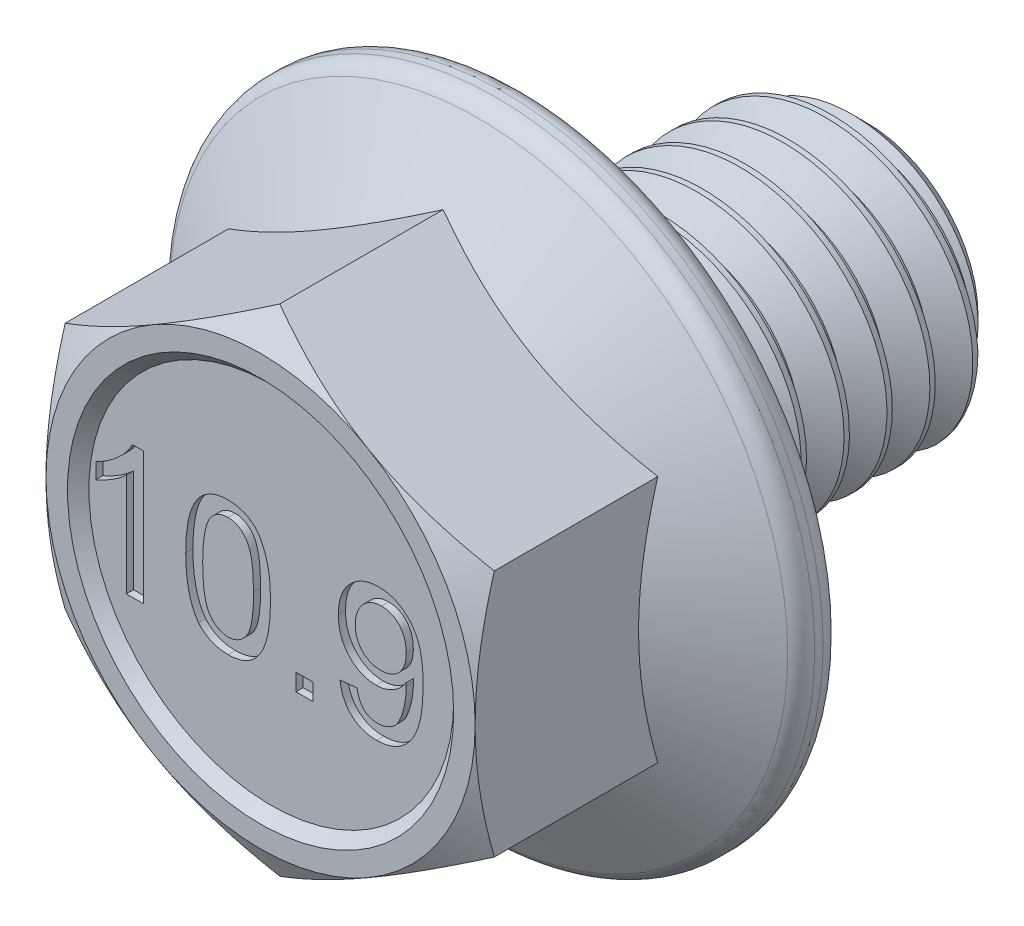
from build123d import *

# Parameters (mm, degrees)
BOSS_EXTRUDE1_REACH = 28.421
SKETCH4_OUTSIDE_W   = 126.89
SKETCH4_OUTSIDE_H   = 126.89
SKETCH4_OUTSIDE_R   = 7.5
CUT_EXTRUDE1_DEPTH  = 27.421298227
CUT_EXTRUDE1_DRAFT  = -60
FILLET1_R           = 0.69
SKETCH5_R           = 6.75
BOSS_EXTRUDE3_DEPTH = 0.375
BOSS_EXTRUDE3_DRAFT = -45
SKETCH8_W           = 0.592688927
SKETCH8_H           = 0.592688927
BOSS_EXTRUDE4_DEPTH = 0.625
CUT_SWEEP1_PITCH    = 1.5
CUT_SWEEP1_TO       = 12


with BuildPart() as part:
    # Sketch2 → Revolve1 (revolve)
    with BuildSketch(Plane(origin=(0, 0, 0), x_dir=(0, 0, -1), z_dir=(1, 0, 0)), mode=Mode.PRIVATE) as revolve1_sk:
        Polygon((-10.6, 0), (10.6, 0), (10.6, 3.875), (9.475, 5), (-1.4, 5), (-1.4, 11.15), (-2.78, 11.15), (-4.887328483, 7.5), (-10.6, 7.5), align=None)
    revolve(revolve1_sk.sketch.rotate(Axis((0, 0, 10.6), (0, 0, -1)), 90), axis=Axis((0, 0, 10.6), (0, 0, -1)))

    # Boss-Extrude1: up to this cone (the profile starts outside it)
    boss_extrude1_end = Plane(origin=(0, 0, 10.6), z_dir=(0, 0, -1)).offset(1.382545499) * Cone(1.732e-06, 47.698004091, 27.538454501, align=(Align.CENTER, Align.CENTER, Align.MIN), mode=Mode.PRIVATE)
    # Sketch3 → Boss-Extrude1 (add, up to the surface)
    with BuildSketch(Plane.XY.offset(10.6), mode=Mode.PRIVATE) as boss_extrude1_sk1:
        Polygon((0, 8.660254038), (-7.5, 4.330127019), (-7.5, -4.330127019), (0, -8.660254038), (7.5, -4.330127019), (7.5, 4.330127019), align=None)
    boss_extrude1_tool1 = extrude(boss_extrude1_sk1.sketch, amount=-BOSS_EXTRUDE1_REACH, mode=Mode.PRIVATE) - boss_extrude1_end
    add(boss_extrude1_tool1.solids().sort_by_distance((0, 0, 10.6))[0])


with BuildPart() as cut_extrude1_tool:
    # Sketch4 outside → Cut-Extrude1 (with draft: the straight prism first)
    with BuildSketch(Plane.XY.offset(10.6)):
        Rectangle(SKETCH4_OUTSIDE_W, SKETCH4_OUTSIDE_H)
        Circle(SKETCH4_OUTSIDE_R, mode=Mode.SUBTRACT)
    extrude(amount=-CUT_EXTRUDE1_DEPTH)
    # Cut-Extrude1: the draft: its side faces are tilted about the plane it starts from
    cut_extrude1_sides = [cut_extrude1_tool.faces().sort_by_distance(p)[0] for p in [
        (0, -63.445, -3.110649113),
        (63.445, 0, -3.110649113),
        (0, 63.445, -3.110649113),
        (-63.445, 0, -3.110649113),
        (-7.5, 0, -3.110649113),
    ]]
    draft(cut_extrude1_sides, Plane.XY.offset(10.6), CUT_EXTRUDE1_DRAFT)


with BuildPart() as part_1:
    add(part.part)

    # Cut-Extrude1: cut by cut_extrude1_tool
    add(cut_extrude1_tool.part, mode=Mode.SUBTRACT)

    # Fillet1
    fillet1_edges = [part_1.edges().sort_by_distance(p)[0] for p in [
        (-11.15, 0, 2.78),
        (-11.15, 0, 1.4),
    ]]
    fillet(fillet1_edges, radius=FILLET1_R)


with BuildPart() as body_2:
    # Sketch5 → Boss-Extrude3 (with draft: the straight prism first)
    with BuildSketch(Plane.XY.offset(10.6)):
        Circle(SKETCH5_R)
    extrude(amount=-BOSS_EXTRUDE3_DEPTH)
    # Boss-Extrude3: the draft: its side faces are tilted about the plane it starts from
    boss_extrude3_sides = [body_2.faces().sort_by_distance(p)[0] for p in [
        (-6.75, 0, 10.4125),
    ]]
    draft(boss_extrude3_sides, Plane.XY.offset(10.6), BOSS_EXTRUDE3_DRAFT)

    # Sketch8 → Boss-Extrude4 (add)
    # profile 1 of 4: a face of its own
    with BuildSketch(Plane.XY.offset(10.6)):
        with BuildLine():
            Line((-4.473167115, -2.5), (-5.065856042, -2.5))
            Line((-5.065856042, -2.5), (-5.065856042, 1.102437386))
            add(Edge.make_bspline(
                [(-5.065856042, 1.102437386), (-5.099983123, 1.069526015), (-5.170912521, 1.001123338), (-5.290811174, 0.904316469), (-5.424633395, 0.806198603), (-5.570641415, 0.711847306), (-5.719471892, 0.623025735), (-5.863297386, 0.543144388), (-5.999716671, 0.475545386), (-6.08957679, 0.438581985), (-6.132696111, 0.42084512)],
                knots=[0, 0, 0, 0, 0.893362401, 1.856755847, 2.901947673, 4.020460078, 5.132200827, 6.168787962, 7.121294059, 8, 8, 8, 8], degree=3))
            Line((-6.132696111, 0.42084512), (-6.132696111, 0.967230225))
            add(Edge.make_bspline(
                [(-6.132696111, 0.967230225), (-6.058634221, 1.005372247), (-5.912662619, 1.080547914), (-5.706436311, 1.210386625), (-5.513901869, 1.351137133), (-5.338246499, 1.502768275), (-5.180782653, 1.657762522), (-5.048085583, 1.814157805), (-4.937053119, 1.96622135), (-4.881346029, 2.072268808), (-4.854710612, 2.122973633)],
                knots=[0, 0, 0, 0, 1.141258006, 2.249351951, 3.335817539, 4.406819942, 5.426913362, 6.360259544, 7.215985427, 8, 8, 8, 8], degree=3))
            Line((-4.854710612, 2.122973633), (-4.473167115, 2.122973633))
            Line((-4.473167115, 2.122973633), (-4.473167115, -2.5))
        make_face()
    # profile 2 of 4: a face of its own
    with BuildSketch(Plane.XY.offset(10.6)):
        with BuildLine():
            add(Edge.make_bspline(
                [(-2.991444797, -0.219999783), (-2.990847663, -0.153933246), (-2.989678128, -0.024536722), (-2.982423886, 0.164793638), (-2.969758566, 0.344592841), (-2.950852731, 0.514704741), (-2.92846468, 0.675513312), (-2.899360072, 0.826789066), (-2.866613157, 0.968871412), (-2.827322736, 1.101612255), (-2.784155425, 1.226152922), (-2.735180734, 1.342293623), (-2.680077563, 1.449911221), (-2.621553891, 1.550121771), (-2.556528911, 1.641366587), (-2.4889274, 1.726206371), (-2.413836485, 1.801529718), (-2.334378607, 1.869274705), (-2.249383728, 1.929055707), (-2.159301555, 1.980639502), (-2.0644787, 2.026184273), (-1.963107945, 2.060470365), (-1.857293726, 2.088420798), (-1.74622154, 2.108981476), (-1.629768989, 2.121102689), (-1.55019004, 2.12234294), (-1.509722479, 2.122973633)],
                knots=[0, 0, 0, 0, 1.514747001, 2.966751498, 4.343369068, 5.64627492, 6.890416844, 8.064737671, 9.177176366, 10.232018008, 11.237056675, 12.19799043, 13.119080079, 14.007588942, 14.855863561, 15.685992447, 16.491747269, 17.290132607, 18.077525251, 18.870243746, 19.668095604, 20.485086593, 21.319398728, 22.175900658, 23.072407314, 24, 24, 24, 24], degree=3))
            add(Edge.make_bspline(
                [(-1.509722479, 2.122973633), (-1.450351303, 2.121228162), (-1.333714247, 2.117799115), (-1.163423544, 2.089832431), (-1.002935531, 2.041991108), (-0.852354477, 1.977451098), (-0.714254542, 1.895472864), (-0.590925479, 1.795815831), (-0.483697592, 1.679526378), (-0.393741106, 1.545226514), (-0.315110159, 1.396621124), (-0.245256151, 1.233043214), (-0.182110158, 1.054676091), (-0.137300386, 0.895012615), (-0.105337612, 0.757185438), (-0.084180796, 0.643509481), (-0.066616396, 0.520852483), (-0.053159693, 0.389511185), (-0.042118785, 0.249632898), (-0.033592398, 0.10113053), (-0.029264384, -0.056367074), (-0.028429468, -0.164433017), (-0.02800016, -0.219999783)],
                knots=[0, 0, 0, 0, 1.134486744, 2.228744715, 3.287356444, 4.328707449, 5.352829806, 6.347195599, 7.349461267, 8.364207941, 9.428085653, 10.559314403, 11.761222316, 13.04268526, 13.726896727, 14.465273606, 15.252205015, 16.094778733, 16.988606776, 17.934225168, 18.937792761, 20, 20, 20, 20], degree=3))
            add(Edge.make_bspline(
                [(-0.02800016, -0.219999783), (-0.02860848, -0.285755995), (-0.029796952, -0.4142237), (-0.036856813, -0.602035949), (-0.050285307, -0.780478655), (-0.066809314, -0.949960578), (-0.091806676, -1.11002928), (-0.118742687, -1.261364852), (-0.15205588, -1.403280096), (-0.190924554, -1.535837211), (-0.234699508, -1.65973711), (-0.282705518, -1.775916161), (-0.335876784, -1.884294976), (-0.395795884, -1.983816483), (-0.459721246, -2.075801663), (-0.528121057, -2.160595574), (-0.602445472, -2.236977786), (-0.68261939, -2.304519574), (-0.767017498, -2.365360707), (-0.857318677, -2.417453789), (-0.953127693, -2.460612003), (-1.053804408, -2.497510132), (-1.160370334, -2.524546916), (-1.271985101, -2.545243152), (-1.389059957, -2.557430595), (-1.468946711, -2.558647673), (-1.509722479, -2.559268893)],
                knots=[0, 0, 0, 0, 1.508974709, 2.94807912, 4.311757619, 5.615040294, 6.854280449, 8.028314546, 9.141715822, 10.197470207, 11.196696834, 12.155719058, 13.080757287, 13.963948316, 14.818758719, 15.649605906, 16.461113142, 17.260189315, 18.052359509, 18.845763934, 19.647754795, 20.461145776, 21.303032214, 22.167241874, 23.064524267, 24, 24, 24, 24], degree=3))
            add(Edge.make_bspline(
                [(-1.509722479, -2.559268893), (-1.563184238, -2.557743893), (-1.667419954, -2.554770564), (-1.819648532, -2.534568623), (-1.962523172, -2.499012257), (-2.097248939, -2.451326158), (-2.222311481, -2.387543254), (-2.33830792, -2.309938897), (-2.447569121, -2.220318633), (-2.510466511, -2.149610302), (-2.542297719, -2.113826121)],
                knots=[0, 0, 0, 0, 1.10322584, 2.150986741, 3.161425019, 4.136713905, 5.093944212, 6.049774532, 7.013026876, 8, 8, 8, 8], degree=3))
            add(Edge.make_bspline(
                [(-2.542297719, -2.113826121), (-2.578936172, -2.060974615), (-2.654486231, -1.951992547), (-2.742911024, -1.766168012), (-2.821787505, -1.561601289), (-2.883691081, -1.334278803), (-2.932177012, -1.086009785), (-2.96719596, -0.816307078), (-2.987013237, -0.525287202), (-2.989934263, -0.324059484), (-2.991444797, -0.219999783)],
                knots=[0, 0, 0, 0, 0.779365345, 1.607084704, 2.489375761, 3.438383567, 4.461919411, 5.557722155, 6.737039282, 8, 8, 8, 8], degree=3))
        make_face()
        with BuildLine():
            add(Edge.make_bspline(
                [(-2.39875587, -0.21814763), (-2.398167377, -0.307064228), (-2.397040871, -0.477270263), (-2.38527162, -0.720438951), (-2.36501134, -0.9398103), (-2.338225927, -1.135080576), (-2.302858336, -1.306513921), (-2.258450143, -1.45367347), (-2.208391546, -1.578325472), (-2.146444982, -1.67892496), (-2.078620336, -1.760928218), (-2.008596025, -1.831453672), (-1.934724617, -1.891398693), (-1.857488116, -1.941380616), (-1.775688141, -1.979223644), (-1.690219162, -2.006652355), (-1.601062581, -2.022437157), (-1.540342898, -2.024705136), (-1.509722479, -2.025848858)],
                knots=[0, 0, 0, 0, 1.89448813, 3.626469325, 5.185477471, 6.587276848, 7.82441448, 8.910550357, 9.859733512, 10.6775885, 11.416198291, 12.123144072, 12.791880183, 13.439617036, 14.078171869, 14.70637855, 15.347637704, 16, 16, 16, 16], degree=3))
            add(Edge.make_bspline(
                [(-1.509722479, -2.025848858), (-1.479109727, -2.024680145), (-1.418405249, -2.02236261), (-1.329042663, -2.006925879), (-1.243906224, -1.978085157), (-1.162228213, -1.94037579), (-1.084430334, -1.891533106), (-1.010921731, -1.831361659), (-0.940528545, -1.76087808), (-0.873008566, -1.677921684), (-0.811533948, -1.57685709), (-0.760536314, -1.452306631), (-0.716820198, -1.304889361), (-0.681258538, -1.13354336), (-0.654362631, -0.938581821), (-0.634224847, -0.719818909), (-0.622376834, -0.4769631), (-0.621268919, -0.307064629), (-0.620689088, -0.21814763)],
                knots=[0, 0, 0, 0, 0.652509534, 1.29391342, 1.924290653, 2.562989607, 3.207355802, 3.876242846, 4.583348185, 5.32723334, 6.150888545, 7.094226006, 8.186903555, 9.424320409, 10.81992305, 12.379283064, 14.105084285, 16, 16, 16, 16], degree=3))
            add(Edge.make_bspline(
                [(-0.620689088, -0.21814763), (-0.621250354, -0.131080706), (-0.622325718, 0.035736225), (-0.634479308, 0.274220262), (-0.653525075, 0.489909552), (-0.679576658, 0.683002941), (-0.714199208, 0.8532908), (-0.756191638, 1.001135649), (-0.806231898, 1.126222183), (-0.865729587, 1.229806901), (-0.93196242, 1.314774471), (-1.001148894, 1.388321295), (-1.075018675, 1.450870474), (-1.154880516, 1.501048347), (-1.238160319, 1.541529989), (-1.326771641, 1.569390486), (-1.419843503, 1.586507104), (-1.483717515, 1.588526498), (-1.516205014, 1.589553598)],
                knots=[0, 0, 0, 0, 1.850066095, 3.544656626, 5.0727657, 6.45041401, 7.682899467, 8.762389858, 9.712573485, 10.538438529, 11.291566246, 11.996865408, 12.681389046, 13.341983376, 13.996294293, 14.643563182, 15.31009126, 16, 16, 16, 16], degree=3))
            add(Edge.make_bspline(
                [(-1.516205014, 1.589553598), (-1.54682351, 1.588749984), (-1.607199262, 1.587165358), (-1.69559727, 1.572040127), (-1.779371023, 1.54674737), (-1.859480299, 1.512485873), (-1.933925211, 1.466376667), (-2.00565806, 1.412540886), (-2.071319157, 1.346947996), (-2.110885958, 1.297911777), (-2.131119776, 1.272835453)],
                knots=[0, 0, 0, 0, 1.021318143, 2.013908504, 2.982026795, 3.937174072, 4.91255697, 5.897578595, 6.924855925, 8, 8, 8, 8], degree=3))
            add(Edge.make_bspline(
                [(-2.131119776, 1.272835453), (-2.153148231, 1.236006099), (-2.199667689, 1.15823026), (-2.251720258, 1.023052646), (-2.29770144, 0.868570364), (-2.335559197, 0.692406591), (-2.362946629, 0.494863519), (-2.384567947, 0.276170558), (-2.395799417, 0.036022385), (-2.397743195, -0.131086748), (-2.39875587, -0.21814763)],
                knots=[0, 0, 0, 0, 0.671104906, 1.417232262, 2.260109084, 3.195198885, 4.23592645, 5.382417421, 6.636286093, 8, 8, 8, 8], degree=3))
        make_face(mode=Mode.SUBTRACT)
    # profile 3 of 4: a face of its own
    with BuildSketch(Plane.XY.offset(10.6)):
        with Locations((1.157377695, -2.203655536)):
            Rectangle(SKETCH8_W, SKETCH8_H)
    # profile 4 of 4: a face of its own
    with BuildSketch(Plane.XY.offset(10.6)):
        with BuildLine():
            Line((2.402024441, -1.373891038), (2.994713369, -1.314622145))
            add(Edge.make_bspline(
                [(2.994713369, -1.314622145), (3.00007163, -1.344989193), (3.010429604, -1.403691272), (3.033804287, -1.487351795), (3.057511949, -1.56535713), (3.088115347, -1.635969506), (3.119986556, -1.70110695), (3.156079824, -1.760116735), (3.197038214, -1.811813667), (3.254876839, -1.872393258), (3.336941427, -1.935609089), (3.450694068, -1.986816376), (3.575832658, -2.021246649), (3.664020906, -2.024279722), (3.709644387, -2.025848858)],
                knots=[0, 0, 0, 0, 0.994516507, 1.922484754, 2.80151264, 3.623050913, 4.402748861, 5.140924173, 5.850441436, 6.526872911, 7.841975818, 9.161260782, 10.53140107, 12, 12, 12, 12], degree=3))
            add(Edge.make_bspline(
                [(3.709644387, -2.025848858), (3.749565377, -2.024411267), (3.828136074, -2.021581865), (3.942694751, -1.999648114), (4.051638273, -1.964510703), (4.153070236, -1.914095877), (4.24662148, -1.852742441), (4.328335336, -1.7798422), (4.39930294, -1.698534877), (4.457589388, -1.604853241), (4.507338446, -1.497853089), (4.554344687, -1.3761736), (4.598811813, -1.237718448), (4.63833158, -1.084253581), (4.673719596, -0.921381723), (4.698554564, -0.752793377), (4.713834552, -0.581766161), (4.715469164, -0.466676611), (4.716289487, -0.408919378)],
                knots=[0, 0, 0, 0, 0.897794352, 1.766998465, 2.614902619, 3.466100941, 4.308008728, 5.124841802, 5.922729683, 6.728261092, 7.598214292, 8.574707161, 9.662086263, 10.868425066, 12.139522319, 13.41071447, 14.70057738, 16, 16, 16, 16], degree=3))
            add(Edge.make_bspline(
                [(4.716289487, -0.408919378), (4.716008944, -0.393175406), (4.715337762, -0.355508875), (4.71418322, -0.317853891), (4.713511258, -0.295938052)],
                knots=[0, 0, 0, 0, 0.835966126, 2, 2, 2, 2], degree=3))
            add(Edge.make_bspline(
                [(4.713511258, -0.295938052), (4.684938665, -0.33932761), (4.627839519, -0.42603681), (4.522648789, -0.542411053), (4.402308747, -0.645636587), (4.268646069, -0.734911854), (4.124961202, -0.808178293), (3.973753814, -0.861416655), (3.816327368, -0.894290644), (3.709185452, -0.897909773), (3.655005877, -0.899739896)],
                knots=[0, 0, 0, 0, 0.978840568, 1.956103883, 2.947027447, 3.962820877, 4.980997961, 5.980964245, 6.979013046, 8, 8, 8, 8], degree=3))
            add(Edge.make_bspline(
                [(3.655005877, -0.899739896), (3.60985605, -0.898570114), (3.520977748, -0.896267375), (3.390786673, -0.875801358), (3.265568377, -0.845109589), (3.146509442, -0.798640764), (3.031757483, -0.741170786), (2.922517392, -0.670630793), (2.818620841, -0.5871168), (2.721410341, -0.491668699), (2.632697208, -0.385279299), (2.554462463, -0.270540447), (2.489496437, -0.146891109), (2.435442454, -0.015874607), (2.393734116, 0.123774946), (2.364752281, 0.271730337), (2.345260605, 0.427426778), (2.343601644, 0.534073537), (2.342755549, 0.588464957)],
                knots=[0, 0, 0, 0, 0.975490236, 1.920271282, 2.842894855, 3.757591483, 4.67685385, 5.613562631, 6.563069669, 7.554119451, 8.55387214, 9.553424333, 10.550567425, 11.568071726, 12.613215376, 13.695622473, 14.824733476, 16, 16, 16, 16], degree=3))
            add(Edge.make_bspline(
                [(2.342755549, 0.588464957), (2.344022779, 0.644698859), (2.3465017, 0.754702124), (2.365226965, 0.915540559), (2.39620622, 1.067914961), (2.44138519, 1.211534489), (2.49725647, 1.347321935), (2.567707987, 1.474298298), (2.650026941, 1.59300675), (2.744705182, 1.702302836), (2.848755711, 1.800371678), (2.959227249, 1.887899826), (3.077559329, 1.959847548), (3.201483033, 2.019833998), (3.331936184, 2.066192432), (3.46869582, 2.099699837), (3.612140378, 2.119360936), (3.709892359, 2.121754965), (3.759652516, 2.122973633)],
                knots=[0, 0, 0, 0, 1.151671969, 2.252870106, 3.311924673, 4.331900944, 5.332425074, 6.314476151, 7.300265758, 8.286521684, 9.270545387, 10.225535917, 11.167946231, 12.101233205, 13.04124339, 13.998220545, 14.981004193, 16, 16, 16, 16], degree=3))
            add(Edge.make_bspline(
                [(3.759652516, 2.122973633), (3.795792727, 2.122242709), (3.867627383, 2.120789877), (3.974532263, 2.109697981), (4.078905651, 2.089703024), (4.181428048, 2.064463769), (4.280370189, 2.02942978), (4.377639334, 1.988916558), (4.472062278, 1.939365823), (4.564189212, 1.883020428), (4.653441506, 1.82087082), (4.735558762, 1.749467646), (4.813823159, 1.673692132), (4.886642119, 1.591166094), (4.951712389, 1.500615883), (5.013451562, 1.405242895), (5.068883505, 1.302966059), (5.119433588, 1.193646857), (5.164425122, 1.075034987), (5.201959334, 0.944509255), (5.234134528, 0.801617572), (5.260923549, 0.646170534), (5.280788046, 0.478278964), (5.295407156, 0.298192379), (5.304977659, 0.105773801), (5.305784668, -0.026746558), (5.306200185, -0.094979462)],
                knots=[0, 0, 0, 0, 0.850689348, 1.69088598, 2.526071361, 3.350886897, 4.173587108, 4.994166539, 5.82944675, 6.680632524, 7.535501428, 8.385942454, 9.238956306, 10.098905971, 10.972410977, 11.861345628, 12.77184846, 13.708225841, 14.694799433, 15.754852217, 16.902446579, 18.141290626, 19.466225842, 20.880733292, 22.39393263, 24, 24, 24, 24], degree=3))
            add(Edge.make_bspline(
                [(5.306200185, -0.094979462), (5.305781887, -0.166298803), (5.30496664, -0.30529733), (5.295321001, -0.508199903), (5.280709242, -0.700003404), (5.260830707, -0.880833794), (5.233854934, -1.050415084), (5.201792082, -1.208717631), (5.163979414, -1.356033685), (5.119544021, -1.492376182), (5.069029563, -1.619311973), (5.01368064, -1.738404087), (4.951692914, -1.84947641), (4.883762876, -1.952741952), (4.810762792, -2.048381209), (4.731552884, -2.136137976), (4.64610743, -2.21574698), (4.555515583, -2.28810414), (4.459913302, -2.351868969), (4.360602063, -2.408133499), (4.256461081, -2.454223998), (4.148560955, -2.492034987), (4.03709342, -2.523254094), (3.921150558, -2.544289585), (3.801268024, -2.556203368), (3.720165917, -2.558238169), (3.679083864, -2.559268893)],
                knots=[0, 0, 0, 0, 1.538356107, 2.998194159, 4.380716326, 5.687456969, 6.921258146, 8.08355215, 9.170518603, 10.200253214, 11.174652363, 12.115998813, 13.031191965, 13.915860606, 14.780247615, 15.624154577, 16.462764255, 17.29681422, 18.1223677, 18.939254916, 19.756006416, 20.575278551, 21.404021733, 22.250368457, 23.113728878, 24, 24, 24, 24], degree=3))
            add(Edge.make_bspline(
                [(3.679083864, -2.559268893), (3.635509156, -2.558515482), (3.550255061, -2.557041432), (3.425792854, -2.541541687), (3.30722608, -2.517977023), (3.194899807, -2.483189999), (3.087972819, -2.440368106), (2.988270153, -2.385644163), (2.894019963, -2.322509104), (2.806385007, -2.249689759), (2.726391369, -2.167453538), (2.654012416, -2.077827184), (2.590557397, -1.979649884), (2.536358397, -1.873500461), (2.488350656, -1.760271956), (2.4511316, -1.638446044), (2.420894698, -1.509146321), (2.408416101, -1.41970418), (2.402024441, -1.373891038)],
                knots=[0, 0, 0, 0, 1.08199657, 2.11693069, 3.111083497, 4.081436044, 5.034173265, 5.967546613, 6.901297947, 7.84883568, 8.792454994, 9.747011506, 10.706361727, 11.690764787, 12.70483191, 13.757514363, 14.851376857, 16, 16, 16, 16], degree=3))
        make_face()
        with BuildLine():
            add(Edge.make_bspline(
                [(4.713511258, 0.601430027), (4.712844665, 0.638502494), (4.711547185, 0.710661673), (4.70017968, 0.815941018), (4.681889439, 0.915082889), (4.656217736, 1.008657364), (4.621354801, 1.095672521), (4.580968468, 1.178159931), (4.531580046, 1.253833286), (4.475853885, 1.323711585), (4.414470392, 1.386216111), (4.347624335, 1.440714468), (4.276569026, 1.487431914), (4.199599837, 1.524164391), (4.119246996, 1.55443182), (4.033580315, 1.574213435), (3.943778557, 1.588070851), (3.881951085, 1.589052686), (3.850408008, 1.589553598)],
                knots=[0, 0, 0, 0, 1.20361398, 2.342757417, 3.433960756, 4.474970456, 5.487648377, 6.473933575, 7.452701285, 8.415527761, 9.372491588, 10.291530068, 11.211879743, 12.12647906, 13.055739058, 13.994253148, 14.97671008, 16, 16, 16, 16], degree=3))
            add(Edge.make_bspline(
                [(3.850408008, 1.589553598), (3.817963051, 1.588570428), (3.754046403, 1.58663358), (3.660363843, 1.574160191), (3.571517477, 1.550277494), (3.486907492, 1.518597637), (3.40559417, 1.479410212), (3.330533575, 1.428062708), (3.258581904, 1.36987326), (3.192625028, 1.302365751), (3.132375596, 1.22835106), (3.079289206, 1.1485239), (3.034583741, 1.062845157), (2.998847297, 0.971672053), (2.969642363, 0.875799258), (2.949580649, 0.774369519), (2.937236391, 0.667490819), (2.936050683, 0.594364874), (2.935444476, 0.556978358)],
                knots=[0, 0, 0, 0, 1.007165334, 1.984118292, 2.925321257, 3.856078893, 4.785899085, 5.718627206, 6.671847665, 7.654235469, 8.641842333, 9.630378272, 10.624608936, 11.635186472, 12.665777387, 13.731187195, 14.840042241, 16, 16, 16, 16], degree=3))
            add(Edge.make_bspline(
                [(2.935444476, 0.556978358), (2.936004355, 0.523590919), (2.937102059, 0.45813113), (2.950174505, 0.362598532), (2.967611209, 0.271421394), (2.995408611, 0.185530404), (3.028896404, 0.103678589), (3.072420237, 0.027745801), (3.121423927, -0.0445385), (3.178841239, -0.110752779), (3.2423162, -0.17082074), (3.311643742, -0.223176433), (3.385948186, -0.267993815), (3.465919851, -0.304065455), (3.551079156, -0.331845924), (3.641236015, -0.352297953), (3.736782318, -0.364479688), (3.802216437, -0.36569831), (3.835590784, -0.366319862)],
                knots=[0, 0, 0, 0, 1.102204012, 2.160993585, 3.181057555, 4.164839289, 5.138418409, 6.097303793, 7.050641095, 8.019669129, 8.986440483, 9.932879371, 10.884360123, 11.847412593, 12.824617322, 13.839006415, 14.897795988, 16, 16, 16, 16], degree=3))
            add(Edge.make_bspline(
                [(3.835590784, -0.366319862), (3.866806597, -0.365692236), (3.928246299, -0.364456927), (4.018249006, -0.352223262), (4.103768498, -0.331733304), (4.185188745, -0.303876343), (4.26237778, -0.267817175), (4.334816552, -0.222643638), (4.403905354, -0.170886232), (4.467618932, -0.110410229), (4.525850809, -0.043451468), (4.576210555, 0.030651545), (4.619215077, 0.110553079), (4.653064012, 0.197200232), (4.680175403, 0.289526225), (4.699263625, 0.388115587), (4.711764165, 0.492757858), (4.712920086, 0.564658113), (4.713511258, 0.601430027)],
                knots=[0, 0, 0, 0, 1.017004716, 2.00169281, 2.953445817, 3.879374072, 4.80207141, 5.723561102, 6.657273834, 7.611045633, 8.581233951, 9.544037932, 10.525327521, 11.53237926, 12.57032081, 13.657564536, 14.802009319, 16, 16, 16, 16], degree=3))
        make_face(mode=Mode.SUBTRACT)
    extrude(amount=-BOSS_EXTRUDE4_DEPTH)


with BuildPart() as part_2:
    add(part_1.part)

    # Combine2: cut body 2
    add(body_2.part, mode=Mode.SUBTRACT)


with BuildPart() as body_2_2:
    # Split1: read off the stored shape, not the designer's step
    # Split1: the piece on the far side of the plane
    add(part_2.part)
    split(bisect_by=Plane.XY.offset(1.4), keep=Keep.BOTTOM)

    # Cut-Sweep1: arcs per turn and ends read off the stored shape
    # Cut-Sweep1: the profile of Sketch7 screwed along a right-hand helix through 11 turns, 8 arcs to a turn; built about Z, then put on its axis
    cut_sweep1_z = Axis((0, 0, 0), (0, 0, 1))
    cut_sweep1_corners = [(5.081189882, 0, 0.046875), (4.025721421, 0, -0.5625), (4.025721421, 0, -0.75), (5.081189882, 0, -1.359375)]
    with BuildLine(mode=Mode.PRIVATE) as cut_sweep1_profile:
        Line(cut_sweep1_corners[0], cut_sweep1_corners[1])
        Line(cut_sweep1_corners[1], cut_sweep1_corners[2])
        Line(cut_sweep1_corners[2], cut_sweep1_corners[3])
        Line(cut_sweep1_corners[3], cut_sweep1_corners[0])
    cut_sweep1_cap = Face(cut_sweep1_profile.wire())
    cut_sweep1_turn_angles = [0, 22.5, 45, 67.5, 90, 112.5, 135, 157.5, 180, 202.5, 225, 247.5, 270, 292.5, 315, 337.5, 360]
    cut_sweep1_turn_weights = [1, 0.9238795325112867, 1, 0.9238795325112867, 1, 0.9238795325112867, 1, 0.9238795325112867, 1, 0.9238795325112867, 1, 0.9238795325112867, 1, 0.9238795325112867, 1, 0.9238795325112867, 1]
    cut_sweep1_turn_rails = [Edge.make_bspline([Vector(p[0], p[1], 0).rotate(cut_sweep1_z, cut_sweep1_turn_angles[k]) / cut_sweep1_turn_weights[k] + Vector(0, 0, p[2] + CUT_SWEEP1_PITCH * cut_sweep1_turn_angles[k] / 360) for k in range(17)], [0, 0, 0, 1, 1, 2, 2, 3, 3, 4, 4, 5, 5, 6, 6, 7, 7, 8, 8, 8], 2, cut_sweep1_turn_weights) for p in cut_sweep1_corners]
    cut_sweep1_turn_sides = [Face.make_surface_from_curves(cut_sweep1_turn_rails[p[0]], cut_sweep1_turn_rails[p[1]]) for p in [(0, 1), (1, 2), (2, 3), (3, 0)]]
    cut_sweep1 = Plane(origin=(0, 0, -10.6), x_dir=(0, 1, 0), z_dir=(0, 0, 1)) * split(Solid(Shell([*[p.moved(Location((0, 0, CUT_SWEEP1_PITCH * i))) for i in range(11) for p in cut_sweep1_turn_sides], cut_sweep1_cap, cut_sweep1_cap.rotate(cut_sweep1_z, 3960).moved(Location((0, 0, CUT_SWEEP1_PITCH * 3960 / 360)))])), bisect_by=Plane.XY.offset(CUT_SWEEP1_TO), keep=Keep.BOTTOM, mode=Mode.PRIVATE)
    add(cut_sweep1, mode=Mode.SUBTRACT)


with BuildPart() as part_3:
    add(part_2.part)

    # Split1
    split(bisect_by=Plane.XY.offset(1.4), keep=Keep.TOP)


with BuildPart() as body_2_2_1:
    add(body_2_2.part)

    # Combine1: union part
    add(part_3.part)


solid = body_2_2_1.part
